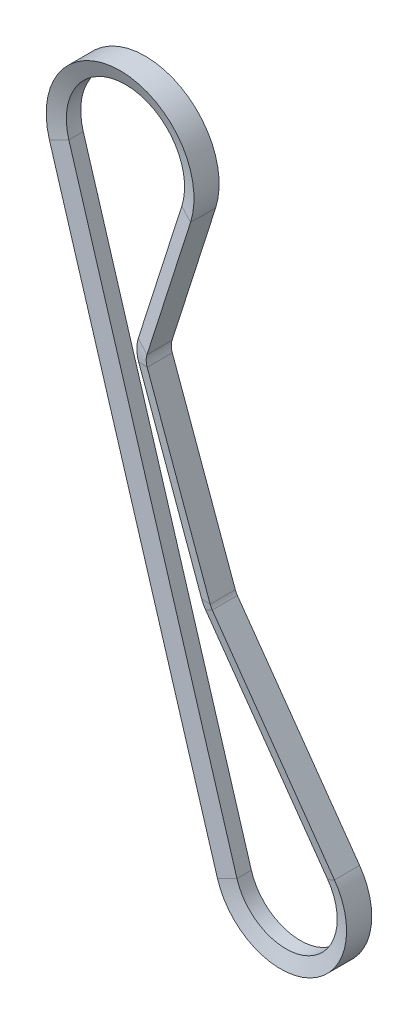
from build123d import *


with BuildPart() as part:
    # Sweep1: sweep along a path in Sketch2
    with BuildLine(Plane.XY) as sweep1_path:
        Line((-23.92916882, -7.238430741), (-87.621436711, 203.318675553))
        ThreePointArc((-87.621436711, 203.318675553), (-60.605680404, 239.424891854), (-34.147809325, 202.907895778))
        Line((-34.147809325, 202.907895778), (-50.640184523, 151.26318831))
        ThreePointArc((-50.640184523, 151.26318831), (-50.93994058, 149.20812418), (-50.560589784, 147.166253654))
        Line((-50.560589784, 147.166253654), (-26.692086092, 81.361280198))
        ThreePointArc((-26.692086092, 81.361280198), (-26.349161714, 80.582908836), (-25.905287195, 79.857350762))
        Line((-25.905287195, 79.857350762), (20.404142781, 14.445447635))
        ThreePointArc((20.404142781, 14.445447635), (10.984265906, -22.45764686), (-23.92916882, -7.238430741))
    # Sketch3 → Sweep1 (sweep)
    with BuildSketch(Plane(origin=(20.404142781, 14.445447635, 0), x_dir=(-0.816165711236352, -0.5778179054010527, 0), z_dir=(0.5778179054010527, -0.816165711236352, 0))):
        Polygon((0, -4.7625), (0, 4.7625), (5.588, 2.728634331), (5.588, -2.728634331), align=None)
    sweep(path=sweep1_path.line)


solid = part.part
